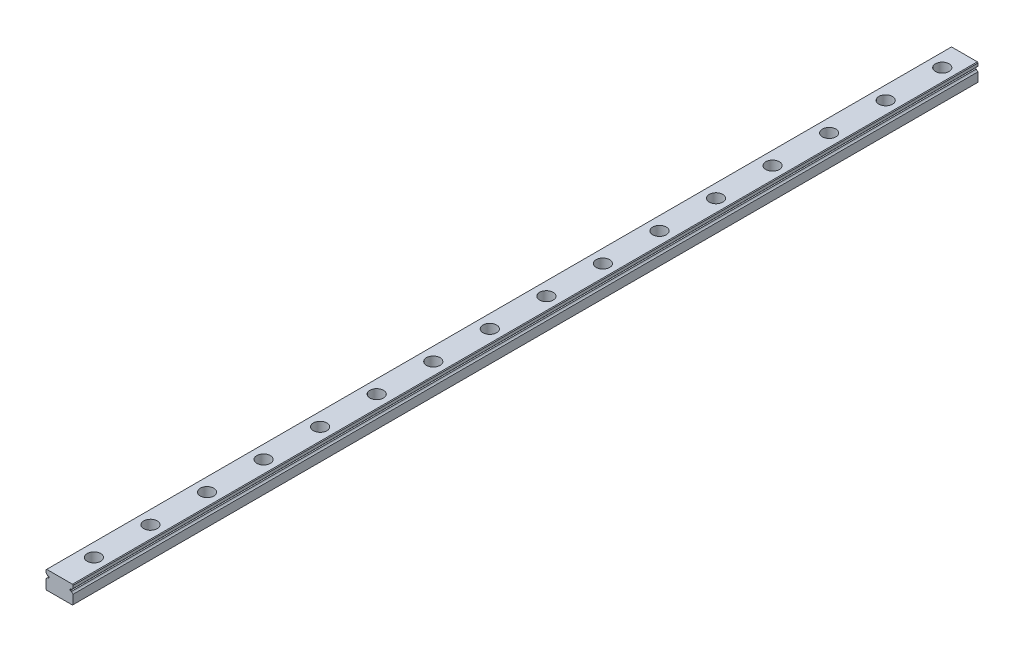
from build123d import *

# Parameters (mm, degrees)
EXTRUDE_1_DEPTH        = 400
SKETCH_2_R             = 3
SKETCH_2_R_2           = 1.75
CUT_EXTRUDE_1_DEPTH    = 4.5
SKETCH_2_2_R           = 1.75
CUT_EXTRUDE_2_DEPTH    = 401.124980475
PATTERN_LINEAR_1_COUNT = 16
PATTERN_LINEAR_1_PITCH = 25


with BuildPart() as part:
    # Эскиз1 → Бобышка-Вытянуть1 (new body)
    with BuildSketch(Plane.XY):
        with BuildLine():
            Line((-6, 3.7), (-5.7, 4))
            Line((-5.7, 4), (5.7, 4))
            Line((5.7, 4), (6, 3.7))
            Line((6, 3.7), (6, 2.449776022))
            ThreePointArc((6, 2.449776022), (5.561887715, 2.168810579), (5.297911886, 1.720256551))
            Line((5.297911886, 1.720256551), (4.687472904, 1.720256551))
            Line((4.687472904, 1.720256551), (4.687472904, 1.082255421))
            Line((4.687472904, 1.082255421), (5.292171789, 1.082255421))
            ThreePointArc((5.292171789, 1.082255421), (5.554928022, 0.621665058), (6, 0.333402583))
            Line((6, 0.333402583), (6, -3.7))
            Line((6, -3.7), (5.7, -4))
            Line((5.7, -4), (-5.7, -4))
            Line((-5.7, -4), (-6, -3.7))
            Line((-6, -3.7), (-6, 0.333402583))
            ThreePointArc((-6, 0.333402583), (-5.554928022, 0.621665058), (-5.292171789, 1.082255421))
            Line((-5.292171789, 1.082255421), (-4.687472904, 1.082255421))
            Line((-4.687472904, 1.082255421), (-4.687472904, 1.720256551))
            Line((-4.687472904, 1.720256551), (-5.297911886, 1.720256551))
            ThreePointArc((-5.297911886, 1.720256551), (-5.561887715, 2.168810579), (-6, 2.449776022))
            Line((-6, 2.449776022), (-6, 3.7))
        make_face()
    extrude(amount=EXTRUDE_1_DEPTH)

    # Эскиз2 → Вырез-Вытянуть1 (cut)
    with BuildSketch(Plane(origin=(0, 4, 0), x_dir=(1, 0, 0), z_dir=(0, 1, 0))):
        with Locations((0.188190244, -10)):
            Circle(SKETCH_2_R)
        with Locations((0.188190244, -10)):
            Circle(SKETCH_2_R_2, mode=Mode.SUBTRACT)
    cut_extrude_1 = extrude(amount=-CUT_EXTRUDE_1_DEPTH, mode=Mode.SUBTRACT)

    # Эскиз2<2> → Вырез-Вытянуть2 (cut, through all)
    with BuildSketch(Plane(origin=(0, 4, 0), x_dir=(1, 0, 0), z_dir=(0, 1, 0))):
        with Locations((0.188190244, -10)):
            Circle(SKETCH_2_2_R)
    cut_extrude_2 = extrude(amount=-CUT_EXTRUDE_2_DEPTH, mode=Mode.SUBTRACT)

    # Линейный массив1: Вырез-Вытянуть1, Вырез-Вытянуть2 ×16
    with Locations(*[(0, 0, i * PATTERN_LINEAR_1_PITCH) for i in range(1, PATTERN_LINEAR_1_COUNT)]):
        add(cut_extrude_1, mode=Mode.SUBTRACT)
        add(cut_extrude_2, mode=Mode.SUBTRACT)


solid = part.part
